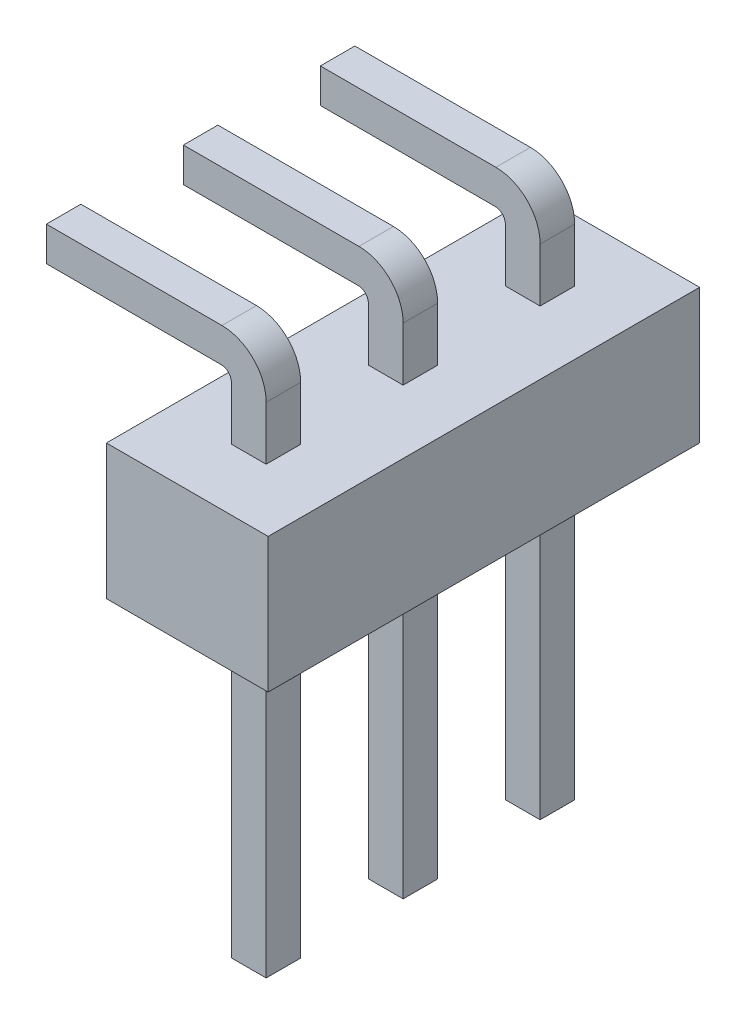
from build123d import *

# Parameters (mm, degrees)
SKETCH1_W       = 3
SKETCH1_H       = 2.5
EXTRUDE1_DEPTH  = 4
SKETCH2_W       = 0.645
SKETCH2_H       = 6
EXTRUDE2_DEPTH  = 0.64
LPATTERN1_COUNT = 3
LPATTERN1_PITCH = 2.54
CHAMFER1_SIZE   = 0.25


with BuildPart() as part:
    # Sketch1 → Extrude1 (new, symmetric)
    with BuildSketch(Plane.XY):
        Rectangle(SKETCH1_W, SKETCH1_H)
    extrude(amount=EXTRUDE1_DEPTH, both=True)

    # Sketch2 → Extrude2 (add)
    with BuildSketch(Plane.XY.offset(2.86)):
        with BuildLine():
            Line((-0.3225, 1.25), (-0.3225, 2.245))
            ThreePointArc((-0.3225, 2.245), (-0.374776878, 2.375), (-0.5025, 2.43261663))
            Line((-0.5025, 2.43261663), (-4.0025, 2.43261663))
            Line((-4.0025, 2.43261663), (-4.0025, 3.06831282))
            Line((-4.0025, 3.06831282), (-0.4975, 3.06831282))
            ThreePointArc((-0.4975, 3.06831282), (0.082527742, 2.826), (0.3225, 2.245))
            Line((0.3225, 2.245), (0.3225, 1.25))
            Line((0.3225, 1.25), (-0.3225, 1.25))
        make_face()
        with Locations((0, -4.25)):
            Rectangle(SKETCH2_W, SKETCH2_H)
    extrude2 = extrude(amount=-EXTRUDE2_DEPTH)

    # LPattern1: Extrude2 ×3
    with Locations(*[(0, 0, -i * LPATTERN1_PITCH) for i in range(1, LPATTERN1_COUNT)]):
        add(extrude2)

    # Chamfer1
    chamfer1_edges = [part.edges().sort_by_distance(p)[0] for p in [
        (-4.0025, 2.43261663, 0),
        (-4.0025, 2.750464725, -0.32),
        (-4.0025, 3.06831282, 0),
        (-4.0025, 2.750464725, 0.32),
        (0.3225, -7.25, 2.54),
        (0, -7.25, 2.22),
        (-0.3225, -7.25, 2.54),
        (0, -7.25, 2.86),
        (0.3225, -7.25, -2.54),
        (0, -7.25, -2.86),
        (-0.3225, -7.25, -2.54),
        (0, -7.25, -2.22),
        (0.3225, -7.25, 0),
        (0, -7.25, -0.32),
        (-0.3225, -7.25, 0),
        (0, -7.25, 0.32),
        (-4.0025, 2.43261663, 2.54),
        (-4.0025, 2.750464725, 2.22),
        (-4.0025, 3.06831282, 2.54),
        (-4.0025, 2.750464725, 2.86),
        (-4.0025, 2.43261663, -2.54),
        (-4.0025, 2.750464725, -2.86),
        (-4.0025, 3.06831282, -2.54),
        (-4.0025, 2.750464725, -2.22),
    ]]
    chamfer(chamfer1_edges, length=CHAMFER1_SIZE)


solid = part.part
